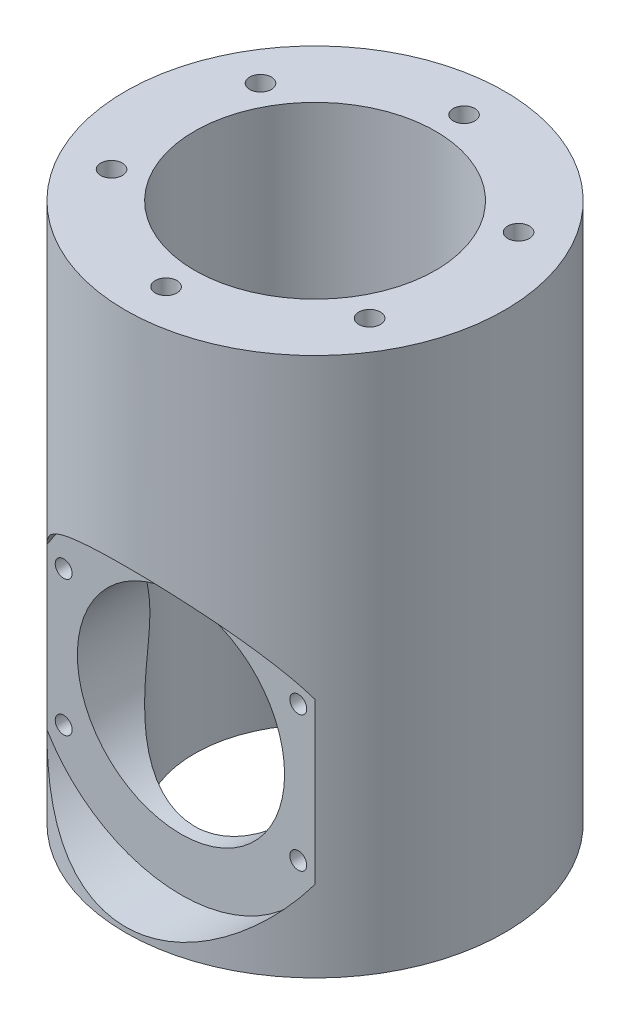
from build123d import *

# Parameters (mm, degrees)
SKETCH1_R                = 7.15
SKETCH1_R_2              = 6.65
BOSS_EXTRUDE1_DEPTH      = 5
BOSS_EXTRUDE2_DEPTH      = 27.9
BOSS_EXTRUDE2_DEPTH_BACK = 11.9
SKETCH2_R                = 14
SKETCH2_R_2              = 8.9
CUT_EXTRUDE3_DEPTH       = 7
CUT_EXTRUDE3_DEPTH_BACK  = 17
SKETCH16_R               = 6.65
CUT_EXTRUDE5_START       = -2
SKETCH23_R               = 7.05
SKETCH23_R_2             = 6.65
CUT_EXTRUDE5_DEPTH       = 2
CUT_EXTRUDE8_DEPTH       = 10
CUT_EXTRUDE8_DEPTH_BACK  = 11.28
SKETCH30_R               = 7.65
CIRPATTERN3_COUNT        = 6
BOSS_EXTRUDE3_REACH      = 50.005
BOSS_EXTRUDE3_END_RADIUS = 7.65
SKETCH39_R               = 1.816793307
CUT_EXTRUDE11_START      = 1
SKETCH38_R               = 11.53
CUT_EXTRUDE11_DEPTH      = 10
CIRPATTERN4_COUNT        = 6


with BuildPart() as part:
    # Sketch1 → Boss-Extrude1 (new body)
    with BuildSketch(Plane.XY):
        Circle(SKETCH1_R)
        Circle(SKETCH1_R_2, mode=Mode.SUBTRACT)
    extrude(amount=BOSS_EXTRUDE1_DEPTH)

    # Sketch2 → Boss-Extrude2 (add, two sides: drawn at the far end of the back side and taken through both)
    with BuildSketch(Plane(origin=(0, 0, 0), x_dir=(1, 0, 0), z_dir=(0, 1, 0)).offset(-BOSS_EXTRUDE2_DEPTH_BACK)):
        with Locations((0, 8.9)):
            Circle(SKETCH2_R)
        with Locations((0, 8.9)):
            Circle(SKETCH2_R_2, mode=Mode.SUBTRACT)
    extrude(amount=BOSS_EXTRUDE2_DEPTH + BOSS_EXTRUDE2_DEPTH_BACK)

    # Sketch16 → Cut-Extrude3 (cut, two sides: drawn at the far end of the back side and taken through both)
    with BuildSketch(Plane.XY.offset(5).offset(-CUT_EXTRUDE3_DEPTH_BACK)):
        Circle(SKETCH16_R)
    extrude(amount=CUT_EXTRUDE3_DEPTH + CUT_EXTRUDE3_DEPTH_BACK, mode=Mode.SUBTRACT)

    # Sketch23 → Cut-Extrude5 (cut)
    with BuildSketch(Plane.XY.offset(5).offset(CUT_EXTRUDE5_START)):
        Circle(SKETCH23_R)
        Circle(SKETCH23_R_2, mode=Mode.SUBTRACT)
    extrude(amount=CUT_EXTRUDE5_DEPTH, mode=Mode.SUBTRACT)

    # Sketch30 → Cut-Extrude8 (cut, two sides: drawn at the far end of the back side and taken through both)
    with BuildSketch(Plane.XY.offset(5).offset(-CUT_EXTRUDE8_DEPTH_BACK)):
        Circle(SKETCH30_R)
    extrude(amount=CUT_EXTRUDE8_DEPTH + CUT_EXTRUDE8_DEPTH_BACK, mode=Mode.SUBTRACT)

    # Sketch47 → Tap Drill for M2 Tap1 (revolve, cut)
    with BuildSketch(Plane(origin=(0, 27.9, 2.1), x_dir=(0, 0, 1), z_dir=(1, 0, 0))):
        Polygon((0, 0), (0, 4.480688495), (0.8, 4), (0.8, 0), align=None)
    tap_drill_for_m2_tap1 = revolve(axis=Axis((0, 34.25, 2.1), (0, -1, 0)), mode=Mode.SUBTRACT)

    # CirPattern3: Tap Drill for M2 Tap1 ×6 about axis
    cirpattern3_axis = Axis((0, -11.9, -8.9), (0, 1, 0))
    for i in range(1, CIRPATTERN3_COUNT):
        add(tap_drill_for_m2_tap1.rotate(cirpattern3_axis, i * 360 / CIRPATTERN3_COUNT), mode=Mode.SUBTRACT)

    # Mirror1 copy 1 sketch → Mirror1 copy 1 (revolve, cut)
    with BuildSketch(Plane(origin=(9.526279442, -11.9, -3.4), x_dir=(0.8660254037844386, 0, 0.5000000000000001), z_dir=(0.5000000000000001, 0, -0.8660254037844386))):
        Polygon((0, 0), (0, -4.480688495), (0.8, -4), (0.8, 0), align=None)
    revolve(axis=Axis((9.526279442, -18.25, -3.4), (0, -1, 0)), mode=Mode.SUBTRACT)

    # Mirror1 copy 2 sketch → Mirror1 copy 2 (revolve, cut)
    with BuildSketch(Plane(origin=(9.526279442, -11.9, -14.4), x_dir=(0.8660254037844387, 0, -0.4999999999999998), z_dir=(-0.4999999999999998, 0, -0.8660254037844387))):
        Polygon((0, 0), (0, -4.480688495), (0.8, -4), (0.8, 0), align=None)
    revolve(axis=Axis((9.526279442, -18.25, -14.4), (0, -1, 0)), mode=Mode.SUBTRACT)

    # Mirror1 copy 3 sketch → Mirror1 copy 3 (revolve, cut)
    with BuildSketch(Plane(origin=(0, -11.9, -19.9), x_dir=(0, 0, -1), z_dir=(-1, 0, 0))):
        Polygon((0, 0), (0, -4.480688495), (0.8, -4), (0.8, 0), align=None)
    revolve(axis=Axis((0, -18.25, -19.9), (0, -1, 0)), mode=Mode.SUBTRACT)

    # Mirror1 copy 4 sketch → Mirror1 copy 4 (revolve, cut)
    with BuildSketch(Plane(origin=(-9.526279442, -11.9, -14.4), x_dir=(-0.8660254037844384, 0, -0.5000000000000004), z_dir=(-0.5000000000000004, 0, 0.8660254037844384))):
        Polygon((0, 0), (0, -4.480688495), (0.8, -4), (0.8, 0), align=None)
    revolve(axis=Axis((-9.526279442, -18.25, -14.4), (0, -1, 0)), mode=Mode.SUBTRACT)

    # Mirror1 copy 5 sketch → Mirror1 copy 5 (revolve, cut)
    with BuildSketch(Plane(origin=(-9.526279442, -11.9, -3.4), x_dir=(-0.8660254037844386, 0, 0.5000000000000001), z_dir=(0.5000000000000001, 0, 0.8660254037844386))):
        Polygon((0, 0), (0, -4.480688495), (0.8, -4), (0.8, 0), align=None)
    revolve(axis=Axis((-9.526279442, -18.25, -3.4), (0, -1, 0)), mode=Mode.SUBTRACT)

    # Mirror1 copy 6 sketch → Mirror1 copy 6 (revolve, cut)
    with BuildSketch(Plane(origin=(0, -11.9, 2.1), x_dir=(0, 0, 1), z_dir=(1, 0, 0))):
        Polygon((0, 0), (0, -4.480688495), (0.8, -4), (0.8, 0), align=None)
    revolve(axis=Axis((0, -18.25, 2.1), (0, -1, 0)), mode=Mode.SUBTRACT)

    # Boss-Extrude3: up to this cylinder (the profile starts outside it)
    boss_extrude3_end = Plane(origin=(0, 0, 2.1), z_dir=(0, 0, -1)) * Cylinder(BOSS_EXTRUDE3_END_RADIUS, 116.31, mode=Mode.PRIVATE)
    # Sketch39 → Boss-Extrude3 (add, up to the surface)
    with BuildSketch(Plane.XZ.offset(11.9), mode=Mode.PRIVATE) as boss_extrude3_sk1:
        with Locations((0, 2.1)):
            Circle(SKETCH39_R)
    boss_extrude3_tool1 = extrude(boss_extrude3_sk1.sketch, amount=-BOSS_EXTRUDE3_REACH, mode=Mode.PRIVATE) - boss_extrude3_end
    add(boss_extrude3_tool1.solids().sort_by_distance((0, -11.9, 2.1))[0])

    # Sketch38 → Cut-Extrude11 (cut)
    with BuildSketch(Plane.XY.offset(CUT_EXTRUDE11_START)):
        Circle(SKETCH38_R)
    extrude(amount=CUT_EXTRUDE11_DEPTH, mode=Mode.SUBTRACT)

    # Sketch49 → Tap Drill for M1.6 Tap1 (revolve, cut)
    with BuildSketch(Plane(origin=(-8.660254038, 5, 1), x_dir=(0, -1, 0), z_dir=(1, 0, 0))):
        Polygon((0, 0), (0, 5.375537887), (0.625, 5), (0.625, 0), align=None)
    tap_drill_for_m1_6_tap1 = revolve(axis=Axis((-8.660254038, 5, 7.35), (0, 0, -1)), mode=Mode.SUBTRACT)

    # CirPattern4: Tap Drill for M1.6 Tap1 ×6 about axis, 2 skipped
    cirpattern4_axis = Axis((0, 0, 15), (0, 0, 1))
    add([tap_drill_for_m1_6_tap1.rotate(cirpattern4_axis, i * 360 / CIRPATTERN4_COUNT) for i in range(1, CIRPATTERN4_COUNT) if i not in (2, 5)], mode=Mode.SUBTRACT)


solid = part.part
